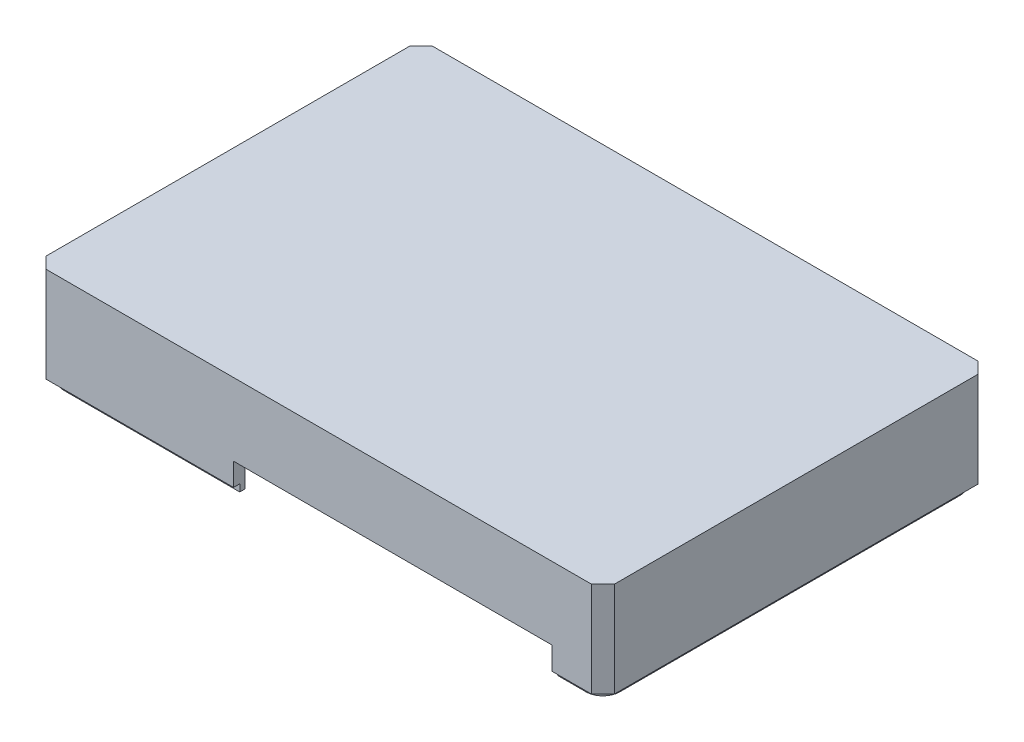
from build123d import *

# Parameters (mm, degrees)
BASE_DEPTH         = 18
SKETCH5_R          = 1.4
SCREW_HOLES_DEPTH  = 16
CHAMBER_DEPTH      = 16
LIP_DEPTH          = 1.25
SKETCH6_W          = 56
SKETCH6_H          = 5.5
CUT_EXTRUDE4_DEPTH = 95.46668408
CUT_EXTRUDE5_REACH = 116.42
SKETCH7_W          = 13.5
SKETCH7_H          = 12.5
SKETCH7_W_2        = 10.5
SKETCH7_H_2        = 12.7
SKETCH7_W_3        = 17
SKETCH7_H_3        = 14.5
RIB3_START         = -17
RIB3_OUTLINE_W     = 96
RIB3_OUTLINE_H     = 1.7
RIB3_DEPTH         = 17
CUT_EXTRUDE6_REACH = 78.759
RIB5_REACH         = 85.106
SKETCH11_WALLS_W   = 1.7
SKETCH11_WALLS_H   = 184.211273102
SKETCH11_WALLS_H_2 = 178.211273102
CUT_EXTRUDE7_REACH = 96.623
FILLET1_START      = 5.25
FILLET1_DEPTH      = 11.75
FILLET1_2_DEPTH    = 5.25
FILLET1_START_2    = 11.5
FILLET1_3_DEPTH    = 5.5
FILLET1_START_3    = 13.5
FILLET1_4_DEPTH    = 3.5
FILLET10_R         = 3
CUT_EXTRUDE9_DEPTH = 4.75


with BuildPart() as part:
    # Sketch1 → base (new body)
    with BuildSketch(Plane(origin=(0, 0, 0), x_dir=(1, 0, 0), z_dir=(0, 1, 0))):
        Polygon((-63.055169503, 13.387929849), (-61.055169503, 15.387929849), (34.944830497, 15.387929849), (36.944830497, 13.387929849), (36.944830497, -50.612070151), (34.944830497, -52.612070151), (-61.055169503, -52.612070151), (-63.055169503, -50.612070151), align=None)
    extrude(amount=BASE_DEPTH)

    # Sketch5 → screw holes (cut)
    with BuildSketch(Plane.XZ):
        with Locations(Location((-57.555169503, -9.887929849, 0), (0, 0, 270))):
            Circle(SKETCH5_R)
        with Locations(Location((31.444830497, -9.887929849, 0), (0, 0, 270))):
            Circle(SKETCH5_R)
        with Locations(Location((31.444830497, 47.112070151, 0), (0, 0, 270))):
            Circle(SKETCH5_R)
        with Locations(Location((-57.555169503, 47.112070151, 0), (0, 0, 270))):
            Circle(SKETCH5_R)
    extrude(amount=-SCREW_HOLES_DEPTH, mode=Mode.SUBTRACT)

    # Sketch2 → chamber (cut)
    with BuildSketch(Plane.XZ):
        with BuildLine():
            Line((-61.055169503, 44.112070151), (-61.055169503, -6.887929849))
            Line((-61.055169503, -6.887929849), (-58.055169503, -6.887929849))
            ThreePointArc((-58.055169503, -6.887929849), (-55.580295769, -7.913056115), (-54.555169503, -10.387929849))
            Line((-54.555169503, -10.387929849), (-54.555169503, -13.387929849))
            Line((-54.555169503, -13.387929849), (-22.975583026, -13.387929849))
            Line((-22.975583026, -13.387929849), (-22.975583026, -7.387929849))
            Line((-22.975583026, -7.387929849), (21.847338458, -7.387929849))
            Line((21.847338458, -7.387929849), (21.847338458, -13.387929849))
            Line((21.847338458, -13.387929849), (28.444830497, -13.387929849))
            Line((28.444830497, -13.387929849), (28.444830497, -10.387929849))
            ThreePointArc((28.444830497, -10.387929849), (29.469956763, -7.913056115), (31.944830497, -6.887929849))
            Line((31.944830497, -6.887929849), (34.944830497, -6.887929849))
            Line((34.944830497, -6.887929849), (34.944830497, 44.112070151))
            Line((34.944830497, 44.112070151), (31.944830497, 44.112070151))
            ThreePointArc((31.944830497, 44.112070151), (29.469956763, 45.137196417), (28.444830497, 47.612070151))
            Line((28.444830497, 47.612070151), (28.444830497, 50.612070151))
            Line((28.444830497, 50.612070151), (21.847338458, 50.612070151))
            Line((21.847338458, 50.612070151), (21.847338458, 44.612070151))
            Line((21.847338458, 44.612070151), (-22.975583026, 44.612070151))
            Line((-22.975583026, 44.612070151), (-22.975583026, 50.612070151))
            Line((-22.975583026, 50.612070151), (-54.555169503, 50.612070151))
            Line((-54.555169503, 50.612070151), (-54.555169503, 47.612070151))
            ThreePointArc((-54.555169503, 47.612070151), (-55.580295769, 45.137196417), (-58.055169503, 44.112070151))
            Line((-58.055169503, 44.112070151), (-61.055169503, 44.112070151))
        make_face()
    extrude(amount=-CHAMBER_DEPTH, mode=Mode.SUBTRACT)

    # Sketch3 → lip (cut)
    with BuildSketch(Plane.XZ):
        Polygon((-63.055169503, -13.387929849), (-61.055169503, -15.387929849), (34.944830497, -15.387929849), (36.944830497, -13.387929849), (36.944830497, 50.612070151), (34.944830497, 52.612070151), (-61.055169503, 52.612070151), (-63.055169503, 50.612070151), align=None)
        with BuildLine():
            Line((32.844830497, 51.512070151), (-58.955169503, 51.512070151))
            ThreePointArc((-58.955169503, 51.512070151), (-61.076489846, 50.633390495), (-61.955169503, 48.512070151))
            Line((-61.955169503, 48.512070151), (-61.955169503, -11.287929849))
            ThreePointArc((-61.955169503, -11.287929849), (-61.076489846, -13.409250192), (-58.955169503, -14.287929849))
            Line((-58.955169503, -14.287929849), (32.844830497, -14.287929849))
            ThreePointArc((32.844830497, -14.287929849), (34.966150841, -13.409250192), (35.844830497, -11.287929849))
            Line((35.844830497, -11.287929849), (35.844830497, 48.512070151))
            ThreePointArc((35.844830497, 48.512070151), (34.966150841, 50.633390495), (32.844830497, 51.512070151))
        make_face(mode=Mode.SUBTRACT)
    extrude(amount=-LIP_DEPTH, mode=Mode.SUBTRACT)

    # Sketch6 → Cut-Extrude4 (cut, through all)
    with BuildSketch(Plane.XY.offset(52.612070151)):
        with Locations((-0.055169503, 2.5)):
            Rectangle(SKETCH6_W, SKETCH6_H)
    extrude(amount=-CUT_EXTRUDE4_DEPTH, mode=Mode.SUBTRACT)

    # Cut-Extrude5: up to this face of the body (flat: up to its plane)
    cut_extrude5_end = Plane(part.part.faces().sort_by_distance((-61.055169503, 8, 18.612070151))[0])
    # Sketch7 → Cut-Extrude5 (cut, up to the picked face)
    with BuildSketch(Plane.ZY.offset(63.055169503), mode=Mode.PRIVATE) as cut_extrude5_sk1:
        with Locations((0.862070151, 5.25)):
            Rectangle(SKETCH7_W, SKETCH7_H)
    cut_extrude5_tool1 = split(extrude(cut_extrude5_sk1.sketch, amount=-CUT_EXTRUDE5_REACH, mode=Mode.PRIVATE), bisect_by=cut_extrude5_end, keep=Keep.BOTH, mode=Mode.PRIVATE)
    # Sketch7 → Cut-Extrude5 (cut, up to the picked face)
    with BuildSketch(Plane.ZY.offset(63.055169503), mode=Mode.PRIVATE) as cut_extrude5_sk2:
        with Locations((15.362070151, 5.15)):
            Rectangle(SKETCH7_W_2, SKETCH7_H_2)
    cut_extrude5_tool2 = split(extrude(cut_extrude5_sk2.sketch, amount=-CUT_EXTRUDE5_REACH, mode=Mode.PRIVATE), bisect_by=cut_extrude5_end, keep=Keep.BOTH, mode=Mode.PRIVATE)
    # Sketch7 → Cut-Extrude5 (cut, up to the picked face)
    with BuildSketch(Plane.ZY.offset(63.055169503), mode=Mode.PRIVATE) as cut_extrude5_sk3:
        with Locations((35.112070151, 6.25)):
            Rectangle(SKETCH7_W_3, SKETCH7_H_3)
    cut_extrude5_tool3 = split(extrude(cut_extrude5_sk3.sketch, amount=-CUT_EXTRUDE5_REACH, mode=Mode.PRIVATE), bisect_by=cut_extrude5_end, keep=Keep.BOTH, mode=Mode.PRIVATE)
    add(cut_extrude5_tool1.solids().sort_by(Axis((-63.05517, 5.25, 0.86207), (1, 0, 0)))[0], mode=Mode.SUBTRACT)
    add(cut_extrude5_tool2.solids().sort_by(Axis((-63.05517, 5.15, 15.36207), (1, 0, 0)))[0], mode=Mode.SUBTRACT)
    add(cut_extrude5_tool3.solids().sort_by(Axis((-63.05517, 6.25, 35.11207), (1, 0, 0)))[0], mode=Mode.SUBTRACT)

    # Rib3: read off the stored shape, not the designer's step
    # Rib3 outline → Rib3 (add)
    with BuildSketch(Plane.XZ.offset(RIB3_START)):
        with Locations((-13.055169503, 23.662635895)):
            Rectangle(RIB3_OUTLINE_W, RIB3_OUTLINE_H)
        with Locations((-13.055169503, 8.862070151)):
            Rectangle(RIB3_OUTLINE_W, RIB3_OUTLINE_H)
    extrude(amount=RIB3_DEPTH)

    # Cut-Extrude6: up to this face of the body (flat: up to its plane)
    cut_extrude6_end = Plane(part.part.faces().sort_by_distance((-13.055169503, 8, 8.012070151))[0])
    # Sketch10 → Cut-Extrude6 (cut, up to the picked face)
    with BuildSketch(Plane.XY.offset(24.512635895), mode=Mode.PRIVATE) as cut_extrude6_sk1:
        Polygon((-53.055169503, 16), (-56.055169503, 0), (34.944830497, 0), (34.944830497, 16), align=None)
    cut_extrude6_tool1 = split(extrude(cut_extrude6_sk1.sketch, amount=-CUT_EXTRUDE6_REACH, mode=Mode.PRIVATE), bisect_by=cut_extrude6_end, keep=Keep.BOTH, mode=Mode.PRIVATE)
    add(cut_extrude6_tool1.solids().sort_by(Axis((-9.809359, 7.955307, 24.512636), (0, 0, -1)))[0], mode=Mode.SUBTRACT)

    # Sketch11 walls → Rib5 (add, up to next)
    with BuildSketch(Plane.XZ.offset(-5.25), mode=Mode.PRIVATE) as rib5_sk1:
        with Locations((-38.765376264, 42.612070151)):
            Rectangle(SKETCH11_WALLS_W, SKETCH11_WALLS_H)
    rib5_tool1 = extrude(rib5_sk1.sketch, amount=-RIB5_REACH, mode=Mode.PRIVATE) - part.part
    # Sketch11 walls → Rib5 (add, up to next)
    with BuildSketch(Plane.XZ.offset(-5.25), mode=Mode.PRIVATE) as rib5_sk2:
        with Locations((-13.257770198, 39.612070151)):
            Rectangle(SKETCH11_WALLS_W, SKETCH11_WALLS_H_2)
    rib5_tool2 = extrude(rib5_sk2.sketch, amount=-RIB5_REACH, mode=Mode.PRIVATE) - part.part
    # Sketch11 walls → Rib5 (add, up to next)
    with BuildSketch(Plane.XZ.offset(-5.25), mode=Mode.PRIVATE) as rib5_sk3:
        with Locations((11.409969653, 39.612070151)):
            Rectangle(SKETCH11_WALLS_W, SKETCH11_WALLS_H_2)
    rib5_tool3 = extrude(rib5_sk3.sketch, amount=-RIB5_REACH, mode=Mode.PRIVATE) - part.part
    add(rib5_tool1.solids().sort_by_distance((-38.765376264, 5.25, 42.612070151))[0])
    add(rib5_tool2.solids().sort_by_distance((-13.257770198, 5.25, 39.612070151))[0])
    add(rib5_tool3.solids().sort_by_distance((11.409969653, 5.25, 39.612070151))[0])

    # Cut-Extrude7: up to this face of the body (flat: up to its plane)
    cut_extrude7_end = Plane(part.part.faces().sort_by_distance((12.259969653, 10.625, 18.612070151))[0])
    # Sketch12 → Cut-Extrude7 (cut, up to the picked face)
    with BuildSketch(Plane.ZY.offset(39.615376264), mode=Mode.PRIVATE) as cut_extrude7_sk1:
        Polygon((33.612070151, 5.25), (30.612070151, 16), (6.612070151, 16), (3.612070151, 5.25), align=None)
    cut_extrude7_tool1 = split(extrude(cut_extrude7_sk1.sketch, amount=-CUT_EXTRUDE7_REACH, mode=Mode.PRIVATE), bisect_by=cut_extrude7_end, keep=Keep.BOTH, mode=Mode.PRIVATE)
    add(cut_extrude7_tool1.solids().sort_by(Axis((-39.615376, 10.425926, 18.61207), (1, 0, 0)))[0], mode=Mode.SUBTRACT)

    # Fillet1: read off the stored shape, not the designer's step
    # Fillet1 outline → Fillet1 (add)
    with BuildSketch(Plane(origin=(0, 0, 0), x_dir=(1, 0, 0), z_dir=(0, 1, 0)).offset(FILLET1_START)):
        with BuildLine():
            Line((-14.107770198, 7.387929849), (-18.107770198, 7.387929849))
            ThreePointArc((-18.107770198, 7.387929849), (-15.279343073, 6.216356974), (-14.107770198, 3.387929849))
            Line((-14.107770198, 3.387929849), (-14.107770198, 7.387929849))
        make_face()
        with BuildLine():
            Line((-22.975583026, 13.387929849), (-26.975583026, 13.387929849))
            ThreePointArc((-26.975583026, 13.387929849), (-24.147155901, 12.216356974), (-22.975583026, 9.387929849))
            Line((-22.975583026, 9.387929849), (-22.975583026, 13.387929849))
        make_face()
        with BuildLine():
            Line((-33.915376264, 13.387929849), (-37.915376264, 13.387929849))
            Line((-37.915376264, 13.387929849), (-37.915376264, 9.387929849))
            ThreePointArc((-37.915376264, 9.387929849), (-36.743803389, 12.216356974), (-33.915376264, 13.387929849))
        make_face()
        with BuildLine():
            Line((-39.615376264, 13.387929849), (-43.615376264, 13.387929849))
            ThreePointArc((-43.615376264, 13.387929849), (-40.786949139, 12.216356973), (-39.615376264, 9.387929849))
            Line((-39.615376264, 9.387929849), (-39.615376264, 13.387929849))
        make_face()
        with BuildLine():
            ThreePointArc((-54.555169503, 10.387929849), (-54.562990899, 10.154073921), (-54.586420129, 9.921263182))
            ThreePointArc((-54.586420129, 9.921263182), (-53.255257483, 12.39902046), (-50.622135129, 13.387929849))
            Line((-50.622135129, 13.387929849), (-54.555169503, 13.387929849))
            Line((-54.555169503, 13.387929849), (-54.555169503, 10.387929849))
        make_face()
        with BuildLine():
            Line((-61.055169503, 5.887929849), (-59.774969011, 5.887929849))
            ThreePointArc((-59.774969011, 5.887929849), (-58.761507038, 6.572686544), (-57.588502836, 6.919180475))
            ThreePointArc((-57.588502836, 6.919180475), (-57.821313575, 6.895751245), (-58.055169503, 6.887929849))
            Line((-58.055169503, 6.887929849), (-61.055169503, 6.887929849))
            Line((-61.055169503, 6.887929849), (-61.055169503, 5.887929849))
        make_face()
        with BuildLine():
            ThreePointArc((-57.055169503, -8.012070151), (-57.949596694, -7.910787889), (-58.79872908, -7.612070151))
            Line((-58.79872908, -7.612070151), (-61.055169503, -7.612070151))
            Line((-61.055169503, -7.612070151), (-61.055169503, -8.012070151))
            Line((-61.055169503, -8.012070151), (-57.055169503, -8.012070151))
        make_face()
        with BuildLine():
            Line((-61.055169503, -10.112070151), (-58.79872908, -10.112070151))
            ThreePointArc((-58.79872908, -10.112070151), (-57.949596694, -9.813352413), (-57.055169503, -9.712070151))
            Line((-57.055169503, -9.712070151), (-61.055169503, -9.712070151))
            Line((-61.055169503, -9.712070151), (-61.055169503, -10.112070151))
        make_face()
        with BuildLine():
            ThreePointArc((-57.055169503, -22.812635895), (-59.153056889, -22.218347055), (-60.627568746, -20.612070151))
            Line((-60.627568746, -20.612070151), (-61.055169503, -20.612070151))
            Line((-61.055169503, -20.612070151), (-61.055169503, -22.812635895))
            Line((-61.055169503, -22.812635895), (-57.055169503, -22.812635895))
        make_face()
        with BuildLine():
            Line((-61.055169503, -26.612070151), (-60.574807247, -26.612070151))
            ThreePointArc((-60.574807247, -26.612070151), (-59.104283583, -25.077358397), (-57.055169503, -24.512635895))
            Line((-57.055169503, -24.512635895), (-61.055169503, -24.512635895))
            Line((-61.055169503, -24.512635895), (-61.055169503, -26.612070151))
        make_face()
        with BuildLine():
            ThreePointArc((-14.107770198, -40.612070151), (-15.279343073, -43.440497276), (-18.107770198, -44.612070151))
            Line((-18.107770198, -44.612070151), (-14.107770198, -44.612070151))
            Line((-14.107770198, -44.612070151), (-14.107770198, -40.612070151))
        make_face()
        with BuildLine():
            ThreePointArc((-22.975583026, -46.612070151), (-24.147155901, -49.440497276), (-26.975583026, -50.612070151))
            Line((-26.975583026, -50.612070151), (-22.975583026, -50.612070151))
            Line((-22.975583026, -50.612070151), (-22.975583026, -46.612070151))
        make_face()
        with BuildLine():
            Line((-37.915376264, -46.612070151), (-37.915376264, -50.612070151))
            Line((-37.915376264, -50.612070151), (-33.915376264, -50.612070151))
            ThreePointArc((-33.915376264, -50.612070151), (-36.743803389, -49.440497276), (-37.915376264, -46.612070151))
        make_face()
        with BuildLine():
            ThreePointArc((-39.615376264, -46.612070151), (-40.786949139, -49.440497276), (-43.615376264, -50.612070151))
            Line((-43.615376264, -50.612070151), (-39.615376264, -50.612070151))
            Line((-39.615376264, -50.612070151), (-39.615376264, -46.612070151))
        make_face()
        with BuildLine():
            ThreePointArc((-50.622135129, -50.612070151), (-53.255257483, -49.623160762), (-54.586420128, -47.145403484))
            ThreePointArc((-54.586420128, -47.145403484), (-54.562990899, -47.378214223), (-54.555169503, -47.612070151))
            Line((-54.555169503, -47.612070151), (-54.555169503, -50.612070151))
            Line((-54.555169503, -50.612070151), (-50.622135129, -50.612070151))
        make_face()
        with BuildLine():
            ThreePointArc((-57.588502836, -44.143320777), (-58.37527126, -43.954923932), (-59.108039442, -43.612070152))
            Line((-59.108039442, -43.612070152), (-61.055169503, -43.612070151))
            Line((-61.055169503, -43.612070151), (-61.055169503, -44.112070151))
            Line((-61.055169503, -44.112070151), (-58.055169503, -44.112070151))
            ThreePointArc((-58.055169503, -44.112070151), (-57.821313575, -44.119891547), (-57.588502836, -44.143320777))
        make_face()
        with BuildLine():
            ThreePointArc((-12.407770198, 3.387929849), (-11.236197323, 6.216356974), (-8.407770198, 7.387929849))
            Line((-8.407770198, 7.387929849), (-12.407770198, 7.387929849))
            Line((-12.407770198, 7.387929849), (-12.407770198, 3.387929849))
        make_face()
        with BuildLine():
            ThreePointArc((6.559969653, 7.387929849), (9.388396778, 6.216356973), (10.559969653, 3.387929849))
            Line((10.559969653, 3.387929849), (10.559969653, 7.387929849))
            Line((10.559969653, 7.387929849), (6.559969653, 7.387929849))
        make_face()
        with BuildLine():
            Line((12.259969653, 7.387929849), (12.259969653, 3.387929849))
            ThreePointArc((12.259969653, 3.387929849), (13.431542528, 6.216356974), (16.259969653, 7.387929849))
            Line((16.259969653, 7.387929849), (12.259969653, 7.387929849))
        make_face()
        with BuildLine():
            ThreePointArc((16.259969653, -44.612070151), (13.431542528, -43.440497276), (12.259969653, -40.612070151))
            Line((12.259969653, -40.612070151), (12.259969653, -44.612070151))
            Line((12.259969653, -44.612070151), (16.259969653, -44.612070151))
        make_face()
        with BuildLine():
            ThreePointArc((10.559969653, -40.612070151), (9.388396778, -43.440497276), (6.559969653, -44.612070151))
            Line((6.559969653, -44.612070151), (10.559969653, -44.612070151))
            Line((10.559969653, -44.612070151), (10.559969653, -40.612070151))
        make_face()
        with BuildLine():
            ThreePointArc((-8.407770198, -44.612070151), (-11.236197323, -43.440497276), (-12.407770198, -40.612070151))
            Line((-12.407770198, -40.612070151), (-12.407770198, -44.612070151))
            Line((-12.407770198, -44.612070151), (-8.407770198, -44.612070151))
        make_face()
        with BuildLine():
            Line((34.944830497, -44.112070151), (34.944830497, -40.179035777))
            ThreePointArc((34.944830497, -40.179035777), (33.955921108, -42.812158132), (31.478163831, -44.143320777))
            ThreePointArc((31.478163831, -44.143320777), (31.71097457, -44.119891547), (31.944830497, -44.112070151))
            Line((31.944830497, -44.112070151), (34.944830497, -44.112070151))
        make_face()
        with BuildLine():
            ThreePointArc((31.478163831, 6.919180475), (33.955921108, 5.58801783), (34.944830497, 2.954895475))
            Line((34.944830497, 2.954895475), (34.944830497, 6.887929849))
            Line((34.944830497, 6.887929849), (31.944830497, 6.887929849))
            ThreePointArc((31.944830497, 6.887929849), (31.71097457, 6.895751245), (31.478163831, 6.919180475))
        make_face()
    extrude(amount=FILLET1_DEPTH)

    # Fillet1 2 outline → Fillet1 2 (add)
    with BuildSketch(Plane(origin=(0, 0, 0), x_dir=(1, 0, 0), z_dir=(0, 1, 0))):
        with BuildLine():
            ThreePointArc((-54.555169503, 10.387929849), (-54.562990899, 10.154073921), (-54.586420129, 9.921263182))
            ThreePointArc((-54.586420129, 9.921263182), (-53.255257483, 12.39902046), (-50.622135129, 13.387929849))
            Line((-50.622135129, 13.387929849), (-54.555169503, 13.387929849))
            Line((-54.555169503, 13.387929849), (-54.555169503, 10.387929849))
        make_face()
        with BuildLine():
            Line((-61.055169503, 5.887929849), (-59.774969011, 5.887929849))
            ThreePointArc((-59.774969011, 5.887929849), (-58.761507038, 6.572686544), (-57.588502836, 6.919180475))
            ThreePointArc((-57.588502836, 6.919180475), (-57.821313575, 6.895751245), (-58.055169503, 6.887929849))
            Line((-58.055169503, 6.887929849), (-61.055169503, 6.887929849))
            Line((-61.055169503, 6.887929849), (-61.055169503, 5.887929849))
        make_face()
        with BuildLine():
            ThreePointArc((-57.055169503, -8.012070151), (-57.949596694, -7.910787889), (-58.79872908, -7.612070151))
            Line((-58.79872908, -7.612070151), (-61.055169503, -7.612070151))
            Line((-61.055169503, -7.612070151), (-61.055169503, -8.012070151))
            Line((-61.055169503, -8.012070151), (-57.055169503, -8.012070151))
        make_face()
        with BuildLine():
            Line((-61.055169503, -10.112070151), (-58.79872908, -10.112070151))
            ThreePointArc((-58.79872908, -10.112070151), (-57.949596694, -9.813352413), (-57.055169503, -9.712070151))
            Line((-57.055169503, -9.712070151), (-61.055169503, -9.712070151))
            Line((-61.055169503, -9.712070151), (-61.055169503, -10.112070151))
        make_face()
        with BuildLine():
            ThreePointArc((-57.055169503, -22.812635895), (-59.153056889, -22.218347055), (-60.627568746, -20.612070151))
            Line((-60.627568746, -20.612070151), (-61.055169503, -20.612070151))
            Line((-61.055169503, -20.612070151), (-61.055169503, -22.812635895))
            Line((-61.055169503, -22.812635895), (-57.055169503, -22.812635895))
        make_face()
        with BuildLine():
            Line((-61.055169503, -26.612070151), (-60.574807247, -26.612070151))
            ThreePointArc((-60.574807247, -26.612070151), (-59.104283583, -25.077358397), (-57.055169503, -24.512635895))
            Line((-57.055169503, -24.512635895), (-61.055169503, -24.512635895))
            Line((-61.055169503, -24.512635895), (-61.055169503, -26.612070151))
        make_face()
        with BuildLine():
            ThreePointArc((-50.622135129, -50.612070151), (-53.255257483, -49.623160762), (-54.586420128, -47.145403484))
            ThreePointArc((-54.586420128, -47.145403484), (-54.562990899, -47.378214223), (-54.555169503, -47.612070151))
            Line((-54.555169503, -47.612070151), (-54.555169503, -50.612070151))
            Line((-54.555169503, -50.612070151), (-50.622135129, -50.612070151))
        make_face()
        with BuildLine():
            ThreePointArc((-57.588502836, -44.143320777), (-58.37527126, -43.954923932), (-59.108039442, -43.612070152))
            Line((-59.108039442, -43.612070152), (-61.055169503, -43.612070151))
            Line((-61.055169503, -43.612070151), (-61.055169503, -44.112070151))
            Line((-61.055169503, -44.112070151), (-58.055169503, -44.112070151))
            ThreePointArc((-58.055169503, -44.112070151), (-57.821313575, -44.119891547), (-57.588502836, -44.143320777))
        make_face()
        with BuildLine():
            Line((34.944830497, -44.112070151), (34.944830497, -40.179035777))
            ThreePointArc((34.944830497, -40.179035777), (33.955921108, -42.812158132), (31.478163831, -44.143320777))
            ThreePointArc((31.478163831, -44.143320777), (31.71097457, -44.119891547), (31.944830497, -44.112070151))
            Line((31.944830497, -44.112070151), (34.944830497, -44.112070151))
        make_face()
        with BuildLine():
            ThreePointArc((31.478163831, 6.919180475), (33.955921108, 5.58801783), (34.944830497, 2.954895475))
            Line((34.944830497, 2.954895475), (34.944830497, 6.887929849))
            Line((34.944830497, 6.887929849), (31.944830497, 6.887929849))
            ThreePointArc((31.944830497, 6.887929849), (31.71097457, 6.895751245), (31.478163831, 6.919180475))
        make_face()
    extrude(amount=FILLET1_2_DEPTH)

    # Fillet1 3 outline → Fillet1 3 (add)
    with BuildSketch(Plane(origin=(0, 0, 0), x_dir=(1, 0, 0), z_dir=(0, 1, 0)).offset(FILLET1_START_2)):
        with BuildLine():
            ThreePointArc((-61.055169503, 2.954895475), (-60.72117537, 4.555020778), (-59.774969011, 5.887929849))
            Line((-59.774969011, 5.887929849), (-61.055169503, 5.887929849))
            Line((-61.055169503, 5.887929849), (-61.055169503, 2.954895475))
        make_face()
        with BuildLine():
            ThreePointArc((-58.79872908, -7.612070151), (-60.444434785, -6.136424369), (-61.055169503, -4.012070151))
            Line((-61.055169503, -4.012070151), (-61.055169503, -7.612070151))
            Line((-61.055169503, -7.612070151), (-58.79872908, -7.612070151))
        make_face()
        with BuildLine():
            ThreePointArc((-61.055169503, -13.712070151), (-60.444434785, -11.587715933), (-58.79872908, -10.112070151))
            Line((-58.79872908, -10.112070151), (-61.055169503, -10.112070151))
            Line((-61.055169503, -10.112070151), (-61.055169503, -13.712070151))
        make_face()
        with BuildLine():
            ThreePointArc((-60.627568746, -20.612070151), (-60.946801357, -19.737406954), (-61.055169503, -18.812635895))
            Line((-61.055169503, -18.812635895), (-61.055169503, -20.612070151))
            Line((-61.055169503, -20.612070151), (-60.627568746, -20.612070151))
        make_face()
    extrude(amount=FILLET1_3_DEPTH)

    # Fillet1 4 outline → Fillet1 4 (add)
    with BuildSketch(Plane(origin=(0, 0, 0), x_dir=(1, 0, 0), z_dir=(0, 1, 0)).offset(FILLET1_START_3)):
        with BuildLine():
            ThreePointArc((-61.055169503, -28.512635895), (-60.933219978, -27.532470342), (-60.574807247, -26.612070151))
            Line((-60.574807247, -26.612070151), (-61.055169503, -26.612070151))
            Line((-61.055169503, -26.612070151), (-61.055169503, -28.512635895))
        make_face()
        with BuildLine():
            ThreePointArc((-59.108039442, -43.612070152), (-60.534499881, -42.152423758), (-61.055169503, -40.179035777))
            Line((-61.055169503, -40.179035777), (-61.055169503, -43.612070151))
            Line((-61.055169503, -43.612070151), (-59.108039442, -43.612070152))
        make_face()
    extrude(amount=FILLET1_4_DEPTH)

    # Fillet10
    fillet10_edges = [part.edges().sort_by_distance(p)[0] for p in [
        (21.847338458, 10.625, -7.387929849),
        (21.847338458, 10.625, -13.387929849),
        (28.444830497, 8, -13.387929849),
        (-22.975583026, 10.625, -7.387929849),
        (-22.975583026, 10.625, 44.612070151),
        (21.847338458, 10.625, 44.612070151),
        (21.847338458, 10.625, 50.612070151),
        (28.444830497, 8, 50.612070151),
    ]]
    fillet(fillet10_edges, radius=FILLET10_R - 0.0001)  # a hair under: the kernel refuses the full size

    # Sketch14 → Cut-Extrude9 (cut)
    with BuildSketch(Plane.XZ.offset(-5.25)):
        with BuildLine():
            Line((-39.615376264, 3.612070151), (-39.615376264, 6.941357483))
            Line((-39.615376264, 6.941357483), (-37.915376264, 6.941357483))
            Line((-37.915376264, 6.941357483), (-37.915376264, 3.612070151))
            Line((-37.915376264, 3.612070151), (-37.915376264, -9.387929849))
            ThreePointArc((-37.915376264, -9.387929849), (-36.743803389, -12.216356974), (-33.915376264, -13.387929849))
            Line((-33.915376264, -13.387929849), (-43.615376264, -13.387929849))
            ThreePointArc((-43.615376264, -13.387929849), (-40.78694914, -12.216356974), (-39.615376264, -9.387929849))
            Line((-39.615376264, -9.387929849), (-39.615376264, 3.612070151))
        make_face()
    extrude(amount=-CUT_EXTRUDE9_DEPTH, mode=Mode.SUBTRACT)


solid = part.part
